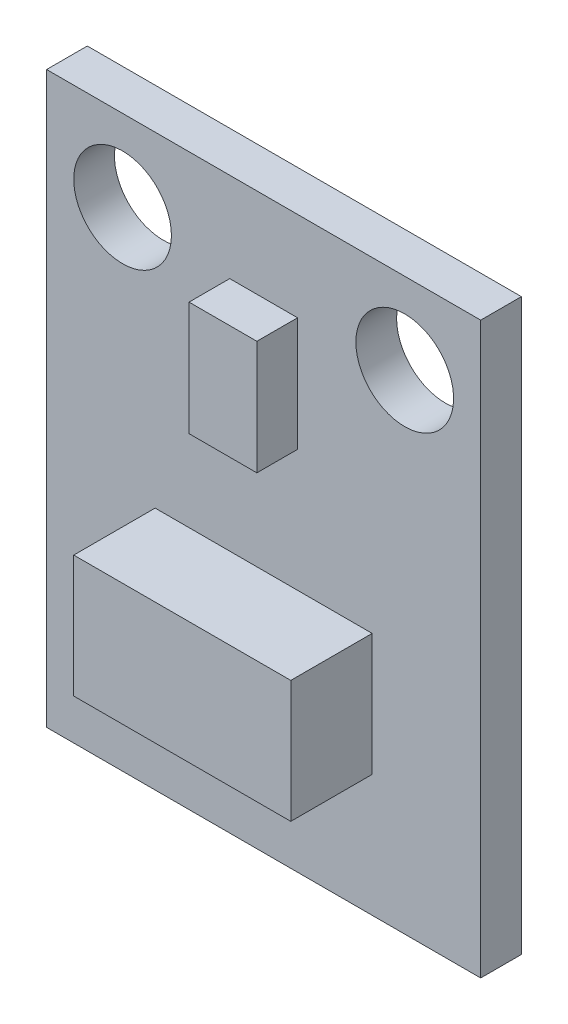
from build123d import *

# Parameters (mm, degrees)
SKETCH1_W           = 16
SKETCH1_H           = 21
SKETCH1_R           = 1.8
BOSS_EXTRUDE1_DEPTH = 1.5
SKETCH2_W           = 2.5
SKETCH2_H           = 4.2
BOSS_EXTRUDE2_DEPTH = 1.5
SKETCH3_W           = 8
SKETCH3_H           = 4.5
BOSS_EXTRUDE3_DEPTH = 3


with BuildPart() as part:
    # Sketch1 → Boss-Extrude1 (new body)
    with BuildSketch(Plane.XY):
        Rectangle(SKETCH1_W, SKETCH1_H)
        with Locations((-5.2, 7.5)):
            Circle(SKETCH1_R, mode=Mode.SUBTRACT)
        with Locations((5.2, 7.5)):
            Circle(SKETCH1_R, mode=Mode.SUBTRACT)
    extrude(amount=BOSS_EXTRUDE1_DEPTH)

    # Sketch2 → Boss-Extrude2 (add)
    with BuildSketch(Plane.XY.offset(1.5)):
        with Locations((0, 5.1)):
            Rectangle(SKETCH2_W, SKETCH2_H)
    extrude(amount=BOSS_EXTRUDE2_DEPTH)

    # Sketch3 → Boss-Extrude3 (add)
    with BuildSketch(Plane.XY.offset(1.5)):
        with Locations((0, -3.75)):
            Rectangle(SKETCH3_W, SKETCH3_H)
    extrude(amount=BOSS_EXTRUDE3_DEPTH)


solid = part.part
